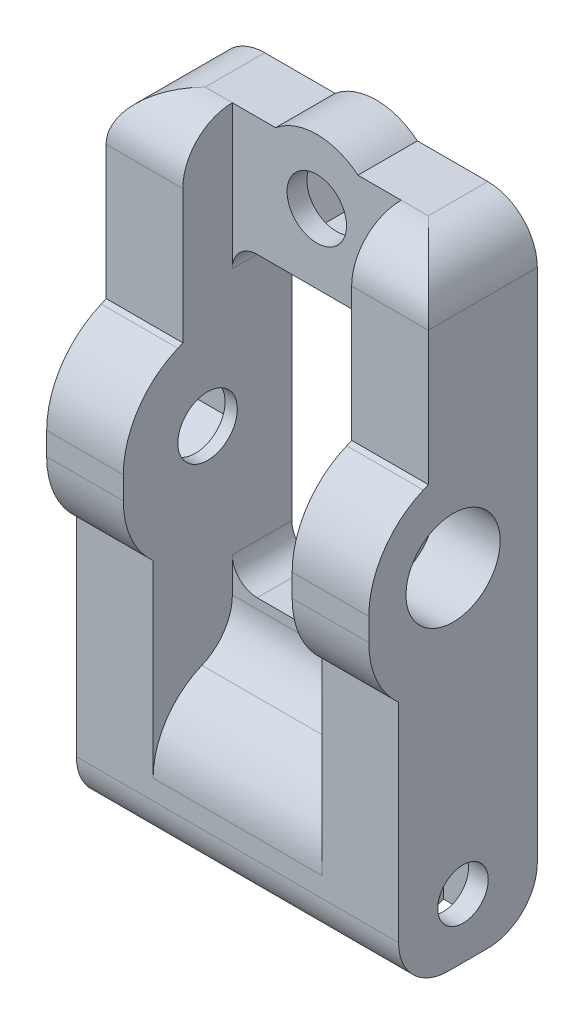
from build123d import *

# Parameters (mm, degrees)
BOSS_EXTRUDE1_DEPTH            = 32.5
SKETCH2_W                      = 32.5
SKETCH2_H                      = 25.708203932
BOSS_EXTRUDE2_DEPTH            = 8
CUT_EXTRUDE1_DEPTH             = 17.032
SKETCH4_W                      = 32.5
SKETCH4_H                      = 8
BOSS_EXTRUDE3_DEPTH            = 7
SKETCH5_W                      = 7.734
SKETCH5_H                      = 11
BOSS_EXTRUDE4_DEPTH            = 29.291796068
SKETCH6_W                      = 7.734
SKETCH6_H                      = 11
BOSS_EXTRUDE5_DEPTH            = 29.291796068
SKETCH7_W                      = 17.032
SKETCH7_H                      = 30
BOSS_EXTRUDE6_DEPTH            = 6
CUT_EXTRUDE3_REACH             = 75.331
CUT_EXTRUDE4_DEPTH             = 6.5
CUT_EXTRUDE5_DEPTH             = 4
SKETCH12_W                     = 4.2
SKETCH12_H                     = 8.5
CUT_EXTRUDE6_DEPTH             = 12.5
SKETCH13_W                     = 4.2
SKETCH13_H                     = 8.5
CUT_EXTRUDE7_DEPTH             = 12.5
F_5_1_5_1_DIAMETER_HOLE1_D     = 5.1
F_5_1_5_1_DIAMETER_HOLE1_DEPTH = 2
F_5_1_5_1_DIAMETER_HOLE2_D     = 5.1
F_5_1_5_1_DIAMETER_HOLE2_DEPTH = 2
F_6_0_6_DIAMETER_HOLE1_D       = 6
F_6_0_6_DIAMETER_HOLE1_DEPTH   = 7.73405
HOLE1_D                        = 6
HOLE1_DEPTH                    = 32.50005
HOLE1_CBORE_D                  = 9.5
HOLE1_CBORE_DEPTH              = 6.5
F_6_0_6_DIAMETER_HOLE2_D       = 6
F_5_1_5_1_DIAMETER_HOLE3_D     = 5.1
F_5_1_5_1_DIAMETER_HOLE3_DEPTH = 26.30005
FILLET1_R                      = 2.5
FILLET2_R                      = 5


with BuildPart() as part:
    # Sketch1 → Boss-Extrude1 (new body)
    with BuildSketch(Plane(origin=(31.766, 0, 0), x_dir=(0, 0, -1), z_dir=(1, 0, 0))):
        with BuildLine():
            Line((-14, 26), (-14, 32.708203932))
            Line((-14, 32.708203932), (-17, 32.708203932))
            ThreePointArc((-17, 32.708203932), (-16.215838363, 29.033969318), (-14, 26))
        make_face()
    extrude(amount=-BOSS_EXTRUDE1_DEPTH)

    # Sketch2 → Boss-Extrude2 (add)
    with BuildSketch(Plane(origin=(0, 0, 14), x_dir=(-1, 0, 0), z_dir=(0, 0, -1))):
        with Locations((-15.516, 19.854101966)):
            Rectangle(SKETCH2_W, SKETCH2_H)
    extrude(amount=BOSS_EXTRUDE2_DEPTH)

    # Sketch3 → Cut-Extrude1 (cut)
    with BuildSketch(Plane(origin=(24.032, 0, 0), x_dir=(0, 0, -1), z_dir=(1, 0, 0))):
        with BuildLine():
            Line((-6, 15), (-6, 32.708203932))
            Line((-6, 32.708203932), (-17, 32.708203932))
            ThreePointArc((-17, 32.708203932), (-16.215838363, 29.033969318), (-14, 26))
            Line((-14, 26), (-14, 7))
            ThreePointArc((-14, 7), (-11.656854249, 12.656854249), (-6, 15))
        make_face()
    extrude(amount=-CUT_EXTRUDE1_DEPTH, mode=Mode.SUBTRACT)

    # Sketch4 → Boss-Extrude3 (add)
    with BuildSketch(Plane.XZ.offset(-7)):
        with Locations((15.516, 10)):
            Rectangle(SKETCH4_W, SKETCH4_H)
    extrude(amount=BOSS_EXTRUDE3_DEPTH)

    # Sketch5 → Boss-Extrude4 (add)
    with BuildSketch(Plane(origin=(0, 32.708203932, 0), x_dir=(-1, 0, 0), z_dir=(0, 1, 0))):
        with Locations((-27.899, 11.5)):
            Rectangle(SKETCH5_W, SKETCH5_H)
    extrude(amount=BOSS_EXTRUDE4_DEPTH)

    # Sketch6 → Boss-Extrude5 (add)
    with BuildSketch(Plane(origin=(0, 32.708203932, 0), x_dir=(-1, 0, 0), z_dir=(0, 1, 0))):
        with Locations((-3.133, 11.5)):
            Rectangle(SKETCH6_W, SKETCH6_H)
    extrude(amount=BOSS_EXTRUDE5_DEPTH)

    # Sketch7 → Boss-Extrude6 (add)
    with BuildSketch(Plane(origin=(0, 0, 6), x_dir=(-1, 0, 0), z_dir=(0, 0, -1))):
        with BuildLine():
            Line((0.734, 62), (0.734, 0))
            Line((0.734, 0), (-31.766, 0))
            Line((-31.766, 0), (-31.766, 62))
            Line((-31.766, 62), (-19.669311931, 62))
            ThreePointArc((-19.669311931, 62), (-15.516, 63.5), (-11.362688069, 62))
            Line((-11.362688069, 62), (0.734, 62))
        make_face()
        with Locations((-15.516, 35)):
            Rectangle(SKETCH7_W, SKETCH7_H, mode=Mode.SUBTRACT)
    extrude(amount=BOSS_EXTRUDE6_DEPTH)

    # Cut-Extrude3: up to this face of the body (flat: up to its plane)
    cut_extrude3_end = Plane(part.part.faces().sort_by_distance((-0.734, 32.469284898, 7.888317221))[0])
    # Sketch9 → Cut-Extrude3 (cut, up to the picked face)
    with BuildSketch(Plane(origin=(31.766, 0, 0), x_dir=(0, 0, -1), z_dir=(1, 0, 0)), mode=Mode.PRIVATE) as cut_extrude3_sk1:
        with BuildLine():
            Line((-11, 43.520866203), (-11, 62))
            Line((-11, 62), (-17, 62))
            Line((-17, 62), (-17, 35))
            ThreePointArc((-17, 35), (-15.5, 39.974937186), (-11.5, 43.291561976))
            ThreePointArc((-11.5, 43.291561976), (-11.248247728, 43.402393245), (-11, 43.520866203))
        make_face()
    cut_extrude3_tool1 = split(extrude(cut_extrude3_sk1.sketch, amount=-CUT_EXTRUDE3_REACH, mode=Mode.PRIVATE), bisect_by=cut_extrude3_end, keep=Keep.BOTH, mode=Mode.PRIVATE)
    add(cut_extrude3_tool1.solids().sort_by(Axis((31.766, 51.50501, 14.153169), (-1, 0, 0)))[0], mode=Mode.SUBTRACT)

    # Sketch10 → Cut-Extrude4 (cut)
    with BuildSketch(Plane.ZY.offset(0.734)):
        Polygon((8.5, 40.051814855), (4.125, 37.525907428), (4.125, 32.474092572), (8.5, 29.948185145), (12.875, 32.474092572), (12.875, 37.525907428), align=None)
    extrude(amount=-CUT_EXTRUDE4_DEPTH, mode=Mode.SUBTRACT)

    # Sketch11 → Cut-Extrude5 (cut)
    with BuildSketch(Plane(origin=(0, 0, 0), x_dir=(-1, 0, 0), z_dir=(0, 0, -1))):
        Polygon((-17.835622857, 61.1), (-20.202758961, 57), (-17.835622857, 52.9), (-13.10135065, 52.9), (-10.734214546, 57), (-13.10135065, 61.1), align=None)
    extrude(amount=-CUT_EXTRUDE5_DEPTH, mode=Mode.SUBTRACT)

    # Sketch12 → Cut-Extrude6 (cut)
    with BuildSketch(Plane.XZ):
        with Locations((27.666, 7.5)):
            Rectangle(SKETCH12_W, SKETCH12_H)
    extrude(amount=-CUT_EXTRUDE6_DEPTH, mode=Mode.SUBTRACT)

    # Sketch13 → Cut-Extrude7 (cut)
    with BuildSketch(Plane.XZ):
        with Locations((3.366, 7.5)):
            Rectangle(SKETCH13_W, SKETCH13_H)
    extrude(amount=-CUT_EXTRUDE7_DEPTH, mode=Mode.SUBTRACT)

    # Ø5.1 (5.1) Diameter Hole1
    with Locations(Plane(origin=(31.766, 0, 0), x_dir=(0, 0, -1), z_dir=(1, 0, 0))):
        with Locations((-7.5, 6)):
            Hole(F_5_1_5_1_DIAMETER_HOLE1_D / 2, depth=F_5_1_5_1_DIAMETER_HOLE1_DEPTH)

    # Ø5.1 (5.1) Diameter Hole2
    with Locations(Plane.ZY.offset(0.734)):
        with Locations((7.5, 6)):
            Hole(F_5_1_5_1_DIAMETER_HOLE2_D / 2, depth=F_5_1_5_1_DIAMETER_HOLE2_DEPTH)

    # Ø6.0 (6) Diameter Hole1
    with Locations(Plane(origin=(7, 0, 0), x_dir=(0, 0, -1), z_dir=(1, 0, 0))):
        with Locations((-8.5, 35)):
            Hole(F_6_0_6_DIAMETER_HOLE1_D / 2, depth=F_6_0_6_DIAMETER_HOLE1_DEPTH)

    # Hole1
    with Locations(Plane(origin=(31.766, 0, 0), x_dir=(0, 0, -1), z_dir=(1, 0, 0))):
        with Locations((-8.5, 35)):
            CounterBoreHole(HOLE1_D / 2, HOLE1_CBORE_D / 2, HOLE1_CBORE_DEPTH, depth=HOLE1_DEPTH)

    # Ø6.0 (6) Diameter Hole2 (through all)
    with Locations(Plane.XY.offset(6)):
        with Locations((15.516, 57)):
            Hole(F_6_0_6_DIAMETER_HOLE2_D / 2)

    # Ø5.1 (5.1) Diameter Hole3
    with Locations(Plane.ZY.offset(-5.466)):
        with Locations((7.5, 6)):
            Hole(F_5_1_5_1_DIAMETER_HOLE3_D / 2, depth=F_5_1_5_1_DIAMETER_HOLE3_DEPTH)

    # Fillet1
    fillet1_edges = [part.edges().sort_by_distance(p)[0] for p in [
        (7, 20, 3),
        (24.032, 20, 3),
        (7, 50, 3),
        (24.032, 50, 3),
    ]]
    fillet(fillet1_edges, radius=FILLET1_R)

    # Fillet2
    # the kernel refuses this fillet: 5 mm, written as the material it adds along each edge
    with BuildSketch(Plane(origin=(34.032, 15, 6), x_dir=(0, 1, 0), z_dir=(-1, 0, 0))) as fillet2_piece_1_section:
        with BuildLine():
            CenterArc((4, -5), FILLET2_R, 90, 67.380135052)
            ThreePointArc((-0.615384615, -3.076923077), (-0.155354594, -1.568929081), (0, 0))
            Line((0, 0), (4, 0))
        make_face()
    fillet2_piece_1 = extrude(amount=27.032, mode=Mode.PRIVATE)
    fillet2_piece_1 = split(fillet2_piece_1, bisect_by=Plane(origin=(31.766, 15.849865024, 6.687390225), z_dir=(-1, 0, 0)), keep=Keep.TOP, mode=Mode.PRIVATE)
    add(fillet2_piece_1)
    # the kernel refuses this fillet: 5 mm, written as the material it takes off along each edge
    with BuildSketch(Plane(origin=(-0.734, 62, 23.5), x_dir=(1, 0, 0), z_dir=(0, 0, -1)), Plane(origin=(31.766, 62, -12.5), x_dir=(-1, 0, 0), z_dir=(0, 0, 1))) as fillet2_2_piece_1:
        with BuildLine():
            CenterArc((FILLET2_R, FILLET2_R), FILLET2_R, 180, 90)
            Line((0, FILLET2_R), (0, 0))
            Line((0, 0), (FILLET2_R, 0))
        make_face()
    extrude(amount=36, mode=Mode.SUBTRACT)
    with BuildSketch(Plane(origin=(-13.234, 0, 0), x_dir=(0, 1, 0), z_dir=(1, 0, 0))) as fillet2_2_piece_2:
        with BuildLine():
            CenterArc((FILLET2_R, FILLET2_R), FILLET2_R, 180, 90)
            Line((0, FILLET2_R), (0, 0))
            Line((0, 0), (FILLET2_R, 0))
        make_face()
    extrude(amount=57.5, mode=Mode.SUBTRACT)
    with BuildSketch(Plane(origin=(44.266, 62, 11), x_dir=(0, -1, 0), z_dir=(-1, 0, 0))) as fillet2_2_piece_3:
        with BuildLine():
            CenterArc((FILLET2_R, -FILLET2_R), FILLET2_R, 90, 90)
            Line((0, -FILLET2_R), (0, 0))
            Line((0, 0), (FILLET2_R, 0))
        make_face()
    extrude(amount=32.734, mode=Mode.SUBTRACT)
    with BuildSketch(Plane(origin=(-13.234, 0, 14), x_dir=(0, 1, 0), z_dir=(1, 0, 0))) as fillet2_2_piece_4:
        with BuildLine():
            CenterArc((FILLET2_R, -FILLET2_R), FILLET2_R, 90, 90)
            Line((0, -FILLET2_R), (0, 0))
            Line((0, 0), (FILLET2_R, 0))
        make_face()
    extrude(amount=57.5, mode=Mode.SUBTRACT)
    with BuildSketch(Plane(origin=(19.5, 62, 11), x_dir=(0, 0, -1), z_dir=(-1, 0, 0))) as fillet2_2_piece_5:
        with BuildLine():
            CenterArc((FILLET2_R, FILLET2_R), FILLET2_R, 180, 90)
            Line((0, FILLET2_R), (0, 0))
            Line((0, 0), (FILLET2_R, 0))
        make_face()
    extrude(amount=32.734, mode=Mode.SUBTRACT)


solid = part.part
